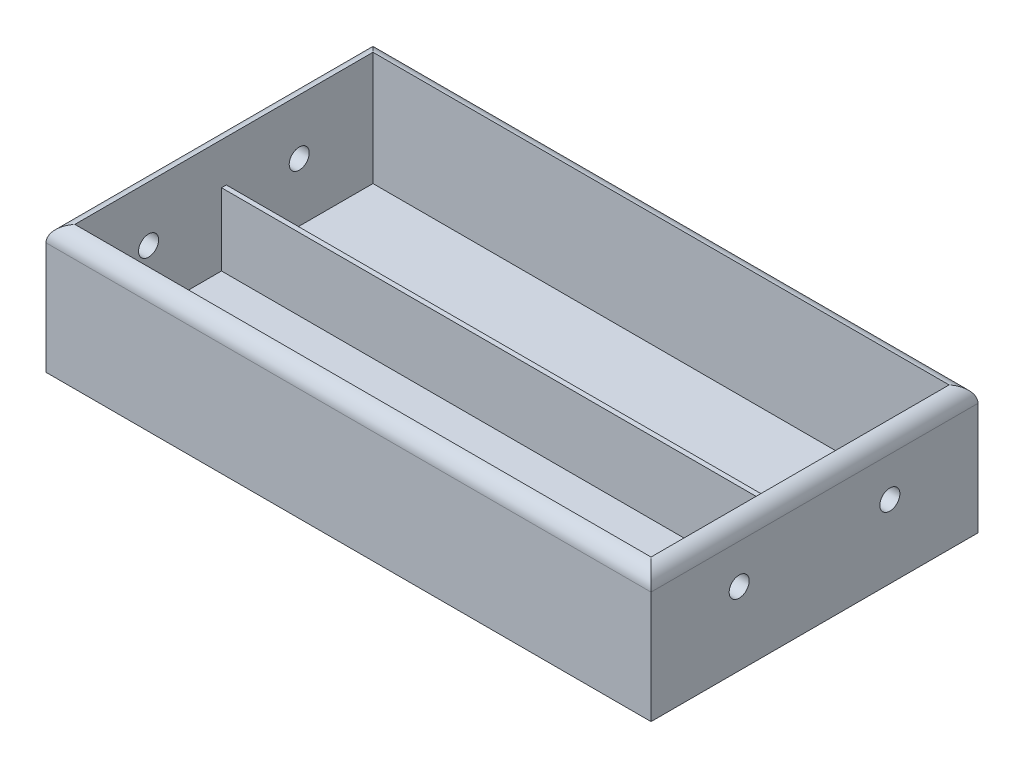
from build123d import *

# Parameters (mm, degrees)
CROQUIS1_W                   = 75.5
CROQUIS1_H                   = 40.8
SALIENTE_EXTRUIR1_DEPTH      = 16
VACIADO1_T                   = -1.8
SALIENTE_EXTRUIR2_DEPTH      = 0.3
SALIENTE_EXTRUIR2_DEPTH_BACK = 0.3
CROQUIS2_W                   = 71.9
CROQUIS2_H                   = 9
CORTAR_EXTRUIR1_REACH        = 81.827
CROQUIS3_R                   = 1.25
MATRIZL1_COUNT               = 2
MATRIZL1_PITCH               = 18.8
REDONDEO1_R                  = 2


with BuildPart() as part:
    # Croquis1 → Saliente-Extruir1 (new body)
    with BuildSketch(Plane(origin=(0, 0, 0), x_dir=(1, 0, 0), z_dir=(0, 1, 0))):
        Rectangle(CROQUIS1_W, CROQUIS1_H)
    extrude(amount=SALIENTE_EXTRUIR1_DEPTH)

    # Vaciado1
    vaciado1_openings = [part.faces().sort_by_distance(p)[0] for p in [
        (0, 16, 0),
    ]]
    offset(amount=VACIADO1_T, openings=vaciado1_openings, kind=Kind.INTERSECTION)

    # Croquis2 → Saliente-Extruir2 (add, two sides: drawn at the far end of the back side and taken through both)
    with BuildSketch(Plane.XY.offset(-SALIENTE_EXTRUIR2_DEPTH_BACK)):
        with Locations((0, 6.3)):
            Rectangle(CROQUIS2_W, CROQUIS2_H)
    extrude(amount=SALIENTE_EXTRUIR2_DEPTH + SALIENTE_EXTRUIR2_DEPTH_BACK)

    # Cortar-Extruir1: up to this face of the body (flat: up to its plane)
    cortar_extruir1_end = Plane(part.part.faces().sort_by_distance((37.75, 8, 0))[0])
    # Croquis3 → Cortar-Extruir1 (cut, up to the picked face)
    with BuildSketch(Plane.ZY.offset(37.75), mode=Mode.PRIVATE) as cortar_extruir1_sk1:
        with Locations((9.4, 9.1)):
            Circle(CROQUIS3_R)
    cortar_extruir1_tool1 = split(extrude(cortar_extruir1_sk1.sketch, amount=-CORTAR_EXTRUIR1_REACH, mode=Mode.PRIVATE), bisect_by=cortar_extruir1_end, keep=Keep.BOTH, mode=Mode.PRIVATE)
    cortar_extruir1 = cortar_extruir1_tool1.solids().sort_by(Axis((-37.75, 9.1, 9.4), (1, 0, 0)))[0]
    add(cortar_extruir1, mode=Mode.SUBTRACT)

    # MatrizL1: Cortar-Extruir1 ×2
    with Locations(*[(0, 0, -i * MATRIZL1_PITCH) for i in range(1, MATRIZL1_COUNT)]):
        add(cortar_extruir1, mode=Mode.SUBTRACT)

    # Redondeo1
    # the kernel refuses this fillet: 2 mm, written as the material it takes off along each edge
    with BuildSketch(Plane(origin=(-42.75, 16, -20.4), x_dir=(0, -1, 0), z_dir=(1, 0, 0))) as redondeo1_piece_1:
        with BuildLine():
            CenterArc((REDONDEO1_R, -REDONDEO1_R), REDONDEO1_R, 90, 90)
            Line((0, -REDONDEO1_R), (0, 0))
            Line((0, 0), (REDONDEO1_R, 0))
        make_face()
    extrude(amount=85.5, mode=Mode.SUBTRACT)
    with BuildSketch(Plane(origin=(-37.75, 16, 25.4), x_dir=(0, -1, 0), z_dir=(0, 0, -1)), Plane(origin=(37.75, 16, -25.4), x_dir=(0, -1, 0), z_dir=(0, 0, 1))) as redondeo1_piece_2:
        with BuildLine():
            CenterArc((REDONDEO1_R, -REDONDEO1_R), REDONDEO1_R, 90, 90)
            Line((0, -REDONDEO1_R), (0, 0))
            Line((0, 0), (REDONDEO1_R, 0))
        make_face()
    extrude(amount=50.8, mode=Mode.SUBTRACT)
    with BuildSketch(Plane(origin=(42.75, 16, 20.4), x_dir=(0, 0, -1), z_dir=(-1, 0, 0))) as redondeo1_piece_3:
        with BuildLine():
            CenterArc((REDONDEO1_R, REDONDEO1_R), REDONDEO1_R, 180, 90)
            Line((0, REDONDEO1_R), (0, 0))
            Line((0, 0), (REDONDEO1_R, 0))
        make_face()
    extrude(amount=85.5, mode=Mode.SUBTRACT)


solid = part.part
